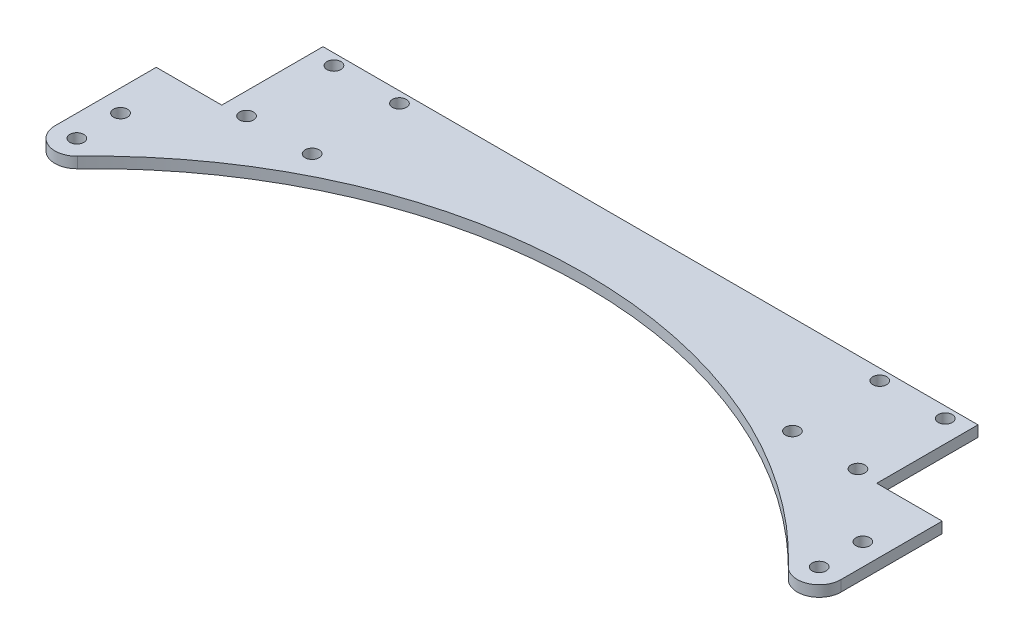
from build123d import *

# Parameters (mm, degrees)
BOSS_EXTRUDE1_DEPTH = 3.175
SKETCH3_R           = 2.032
CUT_EXTRUDE1_DEPTH  = 241.986473946
FILLET1_R           = 6.35
SKETCH4_R           = 2.032
SKETCH4_W           = 19.049980863
SKETCH4_H           = 29.448186152
SKETCH4_W_2         = 19.05
CUT_EXTRUDE2_DEPTH  = 241.986473946


with BuildPart() as part:
    # Sketch1 → Boss-Extrude1 (new body)
    with BuildSketch(Plane(origin=(0, 0, 0), x_dir=(1, 0, 0), z_dir=(0, 1, 0))):
        with BuildLine():
            Line((0, 0), (0, 76.2))
            Line((0, 76.2), (228.6, 76.2))
            Line((228.6, 76.2), (228.6, 0))
            ThreePointArc((228.6, 0), (114.3, 57.15), (0, 0))
        make_face()
    extrude(amount=BOSS_EXTRUDE1_DEPTH)

    # Sketch3 → Cut-Extrude1 (cut, through all)
    with BuildSketch(Plane.XZ):
        with Locations((44.45, -47.625)):
            Circle(SKETCH3_R)
        with Locations((25.4, -47.625)):
            Circle(SKETCH3_R)
        with Locations((44.45, -73.025)):
            Circle(SKETCH3_R)
        with Locations((25.4, -73.025)):
            Circle(SKETCH3_R)
        with Locations((203.2, -47.625)):
            Circle(SKETCH3_R)
        with Locations((203.2, -73.025)):
            Circle(SKETCH3_R)
        with Locations((184.15, -73.025)):
            Circle(SKETCH3_R)
        with Locations((184.15, -47.625)):
            Circle(SKETCH3_R)
    extrude(amount=-CUT_EXTRUDE1_DEPTH, mode=Mode.SUBTRACT)

    # Fillet1
    fillet1_edges = [part.edges().sort_by_distance(p)[0] for p in [
        (0, 1.5875, 0),
        (228.6, 1.5875, 0),
    ]]
    fillet(fillet1_edges, radius=FILLET1_R)

    # Sketch4 → Cut-Extrude2 (cut, through all)
    with BuildSketch(Plane.XZ):
        with Locations((6.35, -17.303627696)):
            Circle(SKETCH4_R)
        with Locations((6.35, -30.003627696)):
            Circle(SKETCH4_R)
        with Locations((222.25, -17.303627696)):
            Circle(SKETCH4_R)
        with Locations((222.25, -30.003627696)):
            Circle(SKETCH4_R)
        with Locations((9.524990432, -61.475906924)):
            Rectangle(SKETCH4_W, SKETCH4_H)
        with Locations((219.075, -61.475906924)):
            Rectangle(SKETCH4_W_2, SKETCH4_H)
    extrude(amount=-CUT_EXTRUDE2_DEPTH, mode=Mode.SUBTRACT)


solid = part.part
